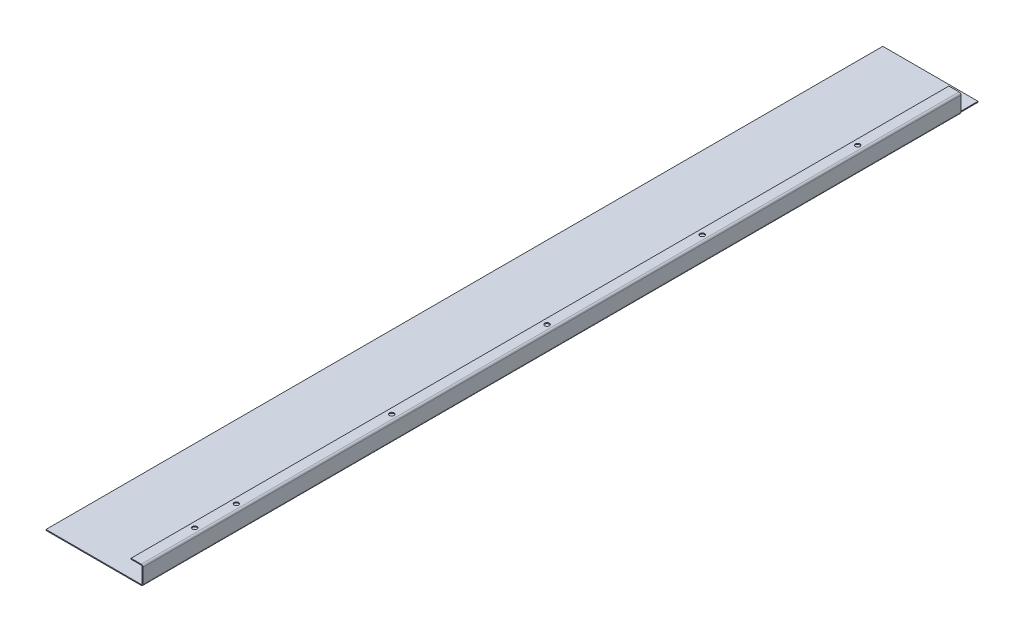
from build123d import *

# Parameters (mm, degrees)
SKETCH1_W                    = 105
SKETCH1_H                    = 905.2
BASE_FLANGE1_DEPTH           = 1
EDGE_FLANGE1_STRIP_W         = 6
EDGE_FLANGE1_STRIP_H         = 1
EDGE_FLANGE1_STRIP_CUT_DEPTH = 905.2
EDGE_FLANGE1_DEPTH           = 905.2
EDGE_FLANGE2_STRIP_W         = 6
EDGE_FLANGE2_STRIP_H         = 1
EDGE_FLANGE2_STRIP_CUT_DEPTH = 905.2
EDGE_FLANGE2_DEPTH           = 905.2
SKETCH19_R                   = 2.5
CUT_EXTRUDE2_DEPTH           = 10
CUT_EXTRUDE3_START           = -905.2
CUT_EXTRUDE3_DEPTH           = 20.5


# Read off the part's stored shape, not the designer's step: Cut-Extrude3
# Sheet-metal steps are written as plain solids
with BuildPart() as part:
    # Sketch1 → Base-Flange1 (new body)
    with BuildSketch(Plane(origin=(0, 0, 0), x_dir=(1, 0, 0), z_dir=(0, 1, 0))):
        with Locations((52.5, 452.6)):
            Rectangle(SKETCH1_W, SKETCH1_H)
    extrude(amount=-BASE_FLANGE1_DEPTH)

    # Edge-Flange1 strip (across the edge) → Edge-Flange1 strip cut (cut)
    with BuildSketch(Plane(origin=(105, 0, 0), x_dir=(-1, 0, 0), z_dir=(0, 0, -1))):
        with Locations((-1, -0.5)):
            Rectangle(EDGE_FLANGE1_STRIP_W, EDGE_FLANGE1_STRIP_H)
    extrude(amount=EDGE_FLANGE1_STRIP_CUT_DEPTH, mode=Mode.SUBTRACT)

    # Edge-Flange1 section (across the edge) → Edge-Flange1 (add)
    with BuildSketch(Plane(origin=(105, 0, 0), x_dir=(-1, 0, 0), z_dir=(0, 0, -1))):
        with BuildLine():
            Line((0, 1), (0, 19))
            Line((0, 19), (1, 19))
            Line((1, 19), (1, 1))
            ThreePointArc((1, 1), (1.292893219, 0.292893219), (2, 0))
            Line((2, 0), (2, -1))
            ThreePointArc((2, -1), (0.585786438, -0.414213562), (0, 1))
        make_face()
    extrude(amount=EDGE_FLANGE1_DEPTH)

    # Edge-Flange2 strip (across the edge) → Edge-Flange2 strip cut (cut)
    with BuildSketch(Plane(origin=(104, 19, 0), x_dir=(0, -1, 0), z_dir=(0, 0, -1))):
        with Locations((-1, -0.5)):
            Rectangle(EDGE_FLANGE2_STRIP_W, EDGE_FLANGE2_STRIP_H)
    extrude(amount=EDGE_FLANGE2_STRIP_CUT_DEPTH, mode=Mode.SUBTRACT)

    # Edge-Flange2 section (across the edge) → Edge-Flange2 (add)
    with BuildSketch(Plane(origin=(104, 19, 0), x_dir=(0, -1, 0), z_dir=(0, 0, -1))):
        with BuildLine():
            Line((0, 1), (0, 12))
            Line((0, 12), (1, 12))
            Line((1, 12), (1, 1))
            ThreePointArc((1, 1), (1.292893219, 0.292893219), (2, 0))
            Line((2, 0), (2, -1))
            ThreePointArc((2, -1), (0.585786438, -0.414213562), (0, 1))
        make_face()
    extrude(amount=EDGE_FLANGE2_DEPTH)

    # Sketch19 → Cut-Extrude2 (cut)
    with BuildSketch(Plane(origin=(0, 19, 0), x_dir=(1, 0, 0), z_dir=(0, 1, 0))):
        with Locations(Location((98, 63, 0), (0, 0, 180))):
            Circle(SKETCH19_R)
        with Locations(Location((98, 108, 0), (0, 0, 180))):
            Circle(SKETCH19_R)
        with Locations(Location((98, 276, 0), (0, 0, 180))):
            Circle(SKETCH19_R)
        with Locations(Location((98, 444, 0), (0, 0, 180))):
            Circle(SKETCH19_R)
        with Locations(Location((98, 612, 0), (0, 0, 180))):
            Circle(SKETCH19_R)
        with Locations(Location((98, 780, 0), (0, 0, 180))):
            Circle(SKETCH19_R)
    extrude(amount=-CUT_EXTRUDE2_DEPTH, mode=Mode.SUBTRACT)

    # Cut-Extrude3 outline → Cut-Extrude3 (cut)
    with BuildSketch(Plane.XY.offset(CUT_EXTRUDE3_START)):
        with BuildLine():
            ThreePointArc((104, 1), (103.707106781, 0.292893219), (103, 0))
            Line((103, 0), (103, -1))
            ThreePointArc((103, -1), (104.414213562, -0.414213562), (105, 1))
            Line((105, 1), (105, 17))
            ThreePointArc((105, 17), (104.414213562, 18.414213562), (103, 19))
            Line((103, 19), (92, 19))
            Line((92, 19), (92, 18))
            Line((92, 18), (103, 18))
            ThreePointArc((103, 18), (103.707106781, 17.707106781), (104, 17))
            Line((104, 17), (104, 1))
        make_face()
    extrude(amount=CUT_EXTRUDE3_DEPTH, mode=Mode.SUBTRACT)


solid = part.part
